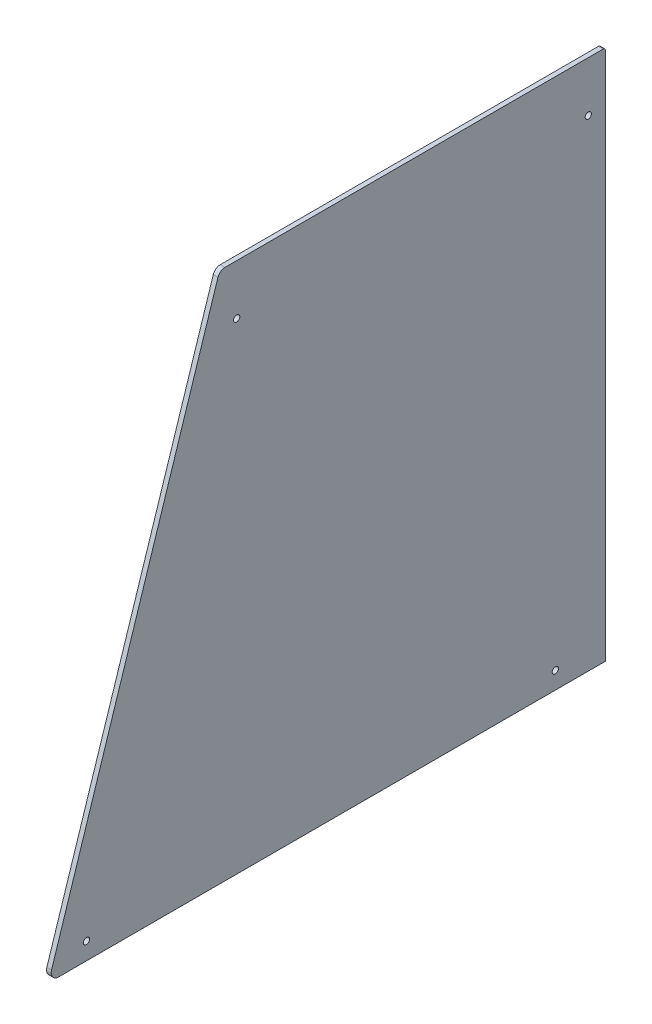
from build123d import *

# Parameters (mm, degrees)
BOSS_EXTRUDE1_DEPTH = 3
CUT_EXTRUDE2_REACH  = 405.513
SKETCH2_R           = 2


with BuildPart() as part:
    # Sketch1 → Boss-Extrude1 (new body)
    with BuildSketch(Plane(origin=(110.5, 0, 0), x_dir=(0, 0, -1), z_dir=(1, 0, 0))):
        with BuildLine():
            Line((122.5, 328.5), (122.5, -10))
            Line((122.5, -10), (-227.5, -10))
            ThreePointArc((-227.5, -10), (-231.293387843, -8.070194473), (-231.967157887, -3.867817213))
            Line((-231.967157887, -3.867817213), (-125.468557887, 326.745775479))
            ThreePointArc((-125.468557887, 326.745775479), (-123.764798126, 329.10018419), (-121.0014, 330))
            Line((-121.0014, 330), (121, 330))
            ThreePointArc((121, 330), (122.060660172, 329.560660172), (122.5, 328.5))
        make_face()
    extrude(amount=-BOSS_EXTRUDE1_DEPTH)

    # Sketch2 → Cut-Extrude2 (cut, up to next)
    with BuildSketch(Plane(origin=(110.5, 0, 0), x_dir=(0, 0, -1), z_dir=(1, 0, 0)), mode=Mode.PRIVATE) as cut_extrude2_sk1:
        with Locations((111.5014, 297.910969137)):
            Circle(SKETCH2_R)
    cut_extrude2_tool1 = extrude(cut_extrude2_sk1.sketch, amount=-CUT_EXTRUDE2_REACH, mode=Mode.PRIVATE) & part.part
    # Sketch2 → Cut-Extrude2 (cut, up to next)
    with BuildSketch(Plane(origin=(110.5, 0, 0), x_dir=(0, 0, -1), z_dir=(1, 0, 0)), mode=Mode.PRIVATE) as cut_extrude2_sk2:
        with Locations((90.410969137, 0.9986)):
            Circle(SKETCH2_R)
    cut_extrude2_tool2 = extrude(cut_extrude2_sk2.sketch, amount=-CUT_EXTRUDE2_REACH, mode=Mode.PRIVATE) & part.part
    # Sketch2 → Cut-Extrude2 (cut, up to next)
    with BuildSketch(Plane(origin=(110.5, 0, 0), x_dir=(0, 0, -1), z_dir=(1, 0, 0)), mode=Mode.PRIVATE) as cut_extrude2_sk3:
        with Locations((-209.589030863, 0.9986)):
            Circle(SKETCH2_R)
    cut_extrude2_tool3 = extrude(cut_extrude2_sk3.sketch, amount=-CUT_EXTRUDE2_REACH, mode=Mode.PRIVATE) & part.part
    # Sketch2 → Cut-Extrude2 (cut, up to next)
    with BuildSketch(Plane(origin=(110.5, 0, 0), x_dir=(0, 0, -1), z_dir=(1, 0, 0)), mode=Mode.PRIVATE) as cut_extrude2_sk4:
        with Locations((-113.4986, 297.910969137)):
            Circle(SKETCH2_R)
    cut_extrude2_tool4 = extrude(cut_extrude2_sk4.sketch, amount=-CUT_EXTRUDE2_REACH, mode=Mode.PRIVATE) & part.part
    add(cut_extrude2_tool1.solids().sort_by_distance((110.5, 297.910969, -111.5014))[0], mode=Mode.SUBTRACT)
    add(cut_extrude2_tool2.solids().sort_by_distance((110.5, 0.9986, -90.410969))[0], mode=Mode.SUBTRACT)
    add(cut_extrude2_tool3.solids().sort_by_distance((110.5, 0.9986, 209.589031))[0], mode=Mode.SUBTRACT)
    add(cut_extrude2_tool4.solids().sort_by_distance((110.5, 297.910969, 113.4986))[0], mode=Mode.SUBTRACT)


solid = part.part
